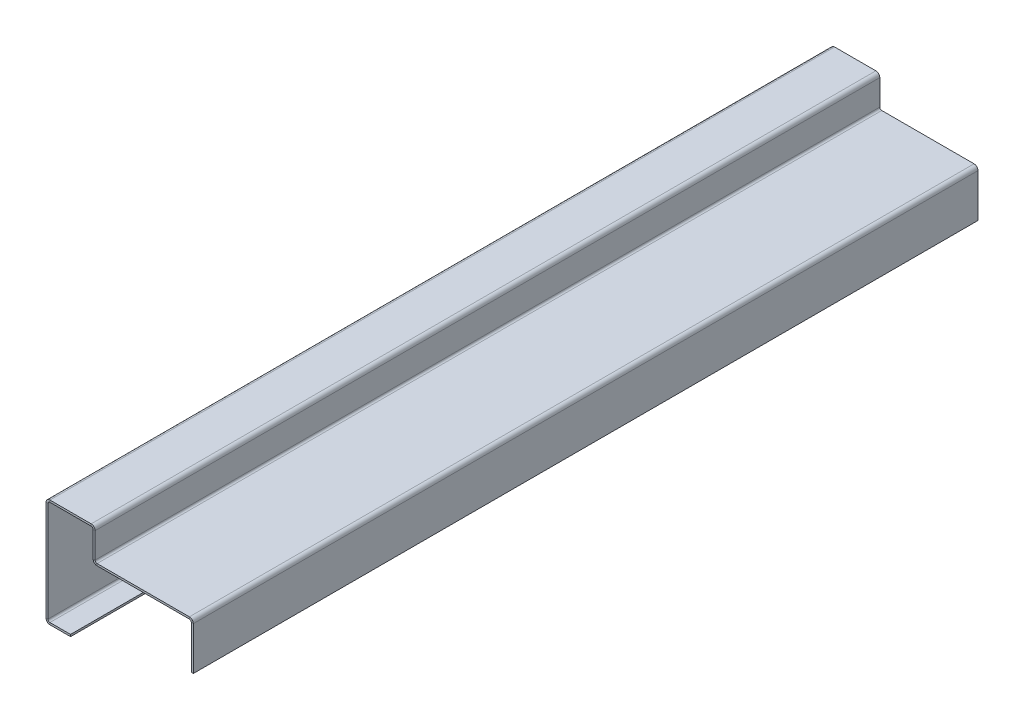
from build123d import *

# Parameters (mm, degrees)
BASE_FLANGE1_DEPTH = 799


# Sheet-metal steps are written as plain solids
with BuildPart() as part:
    # Sketch1 → Base-Flange1 (new body)
    with BuildSketch(Plane.XY):
        with BuildLine():
            Line((25, 0), (4, 0))
            ThreePointArc((4, 0), (1.171572875, 1.171572875), (0, 4))
            Line((0, 4), (0, 106))
            ThreePointArc((0, 106), (1.171572875, 108.828427125), (4, 110))
            Line((4, 110), (46, 110))
            ThreePointArc((46, 110), (48.828427125, 108.828427125), (50, 106))
            Line((50, 106), (50, 80))
            ThreePointArc((50, 80), (50.585786438, 78.585786438), (52, 78))
            Line((52, 78), (146, 78))
            ThreePointArc((146, 78), (148.828427125, 76.828427125), (150, 74))
            Line((150, 74), (150, 30))
            Line((150, 30), (148, 30))
            Line((148, 30), (148, 74))
            ThreePointArc((148, 74), (147.414213562, 75.414213562), (146, 76))
            Line((146, 76), (52, 76))
            ThreePointArc((52, 76), (49.171572875, 77.171572875), (48, 80))
            Line((48, 80), (48, 106))
            ThreePointArc((48, 106), (47.414213562, 107.414213562), (46, 108))
            Line((46, 108), (4, 108))
            ThreePointArc((4, 108), (2.585786438, 107.414213562), (2, 106))
            Line((2, 106), (2, 4))
            ThreePointArc((2, 4), (2.585786438, 2.585786438), (4, 2))
            Line((4, 2), (25, 2))
            Line((25, 2), (25, 0))
        make_face()
    extrude(amount=BASE_FLANGE1_DEPTH)


solid = part.part
